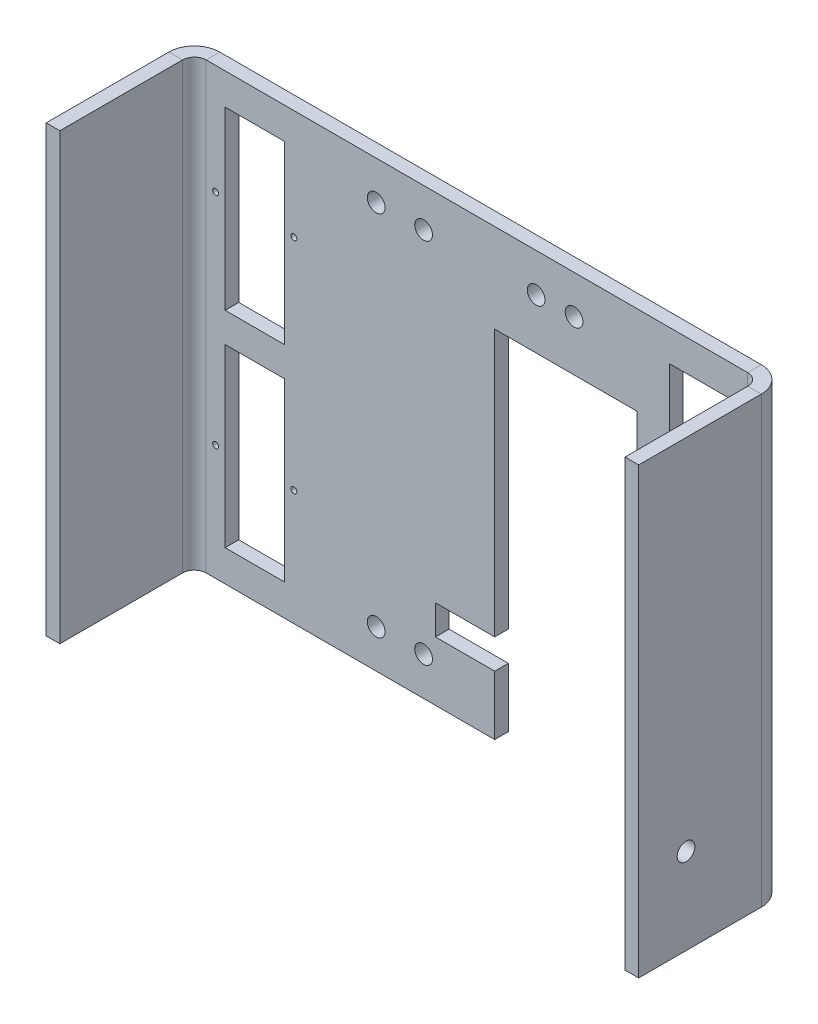
from build123d import *

# Parameters (mm, degrees)
SKETCH2_W                    = 100
SKETCH2_H                    = 75
BASE_FLANGE1_DEPTH           = 2.3
EDGE_FLANGE1_STRIP_W         = 13.2
EDGE_FLANGE1_STRIP_H         = 2.3
EDGE_FLANGE1_STRIP_CUT_DEPTH = 75
EDGE_FLANGE1_DEPTH           = 75
EDGE_FLANGE2_STRIP_W         = 13.2
EDGE_FLANGE2_STRIP_H         = 2.3
EDGE_FLANGE2_STRIP_CUT_DEPTH = 75
EDGE_FLANGE2_DEPTH           = 75
CUT_EXTRUDE1_REACH           = 129.475
SKETCH13_R                   = 1.5
SKETCH13_W                   = 10
SKETCH13_H                   = 64.4
SKETCH14_W                   = 10
SKETCH14_H                   = 5
TAB1_DEPTH                   = 2.3
CUT_EXTRUDE2_REACH           = 129.475
SKETCH17_R                   = 0.5
CUT_EXTRUDE3_REACH           = 129.044
SKETCH18_R                   = 1.5


# Sheet-metal steps are written as plain solids
with BuildPart() as part:
    # Sketch2 → Base-Flange1 (new body)
    with BuildSketch(Plane.XY):
        with Locations((50, 37.5)):
            Rectangle(SKETCH2_W, SKETCH2_H)
    extrude(amount=-BASE_FLANGE1_DEPTH)

    # Edge-Flange1 strip (across the edge) → Edge-Flange1 strip cut (cut)
    with BuildSketch(Plane.XZ.offset(-75)):
        with Locations((-2.3, -1.15)):
            Rectangle(EDGE_FLANGE1_STRIP_W, EDGE_FLANGE1_STRIP_H)
    extrude(amount=EDGE_FLANGE1_STRIP_CUT_DEPTH, mode=Mode.SUBTRACT)

    # Edge-Flange1 section (across the edge) → Edge-Flange1 (add)
    with BuildSketch(Plane.XZ.offset(-75)):
        with BuildLine():
            Line((0, 2), (0, 22.7))
            Line((0, 22.7), (2.3, 22.7))
            Line((2.3, 22.7), (2.3, 2))
            ThreePointArc((2.3, 2), (2.885786438, 0.585786438), (4.3, 0))
            Line((4.3, 0), (4.3, -2.3))
            ThreePointArc((4.3, -2.3), (1.259440841, -1.040559159), (0, 2))
        make_face()
    extrude(amount=EDGE_FLANGE1_DEPTH)

    # Edge-Flange2 strip (across the edge) → Edge-Flange2 strip cut (cut)
    with BuildSketch(Plane(origin=(100, 0, 0), x_dir=(-1, 0, 0), z_dir=(0, 1, 0))):
        with Locations((-2.3, -1.15)):
            Rectangle(EDGE_FLANGE2_STRIP_W, EDGE_FLANGE2_STRIP_H)
    extrude(amount=EDGE_FLANGE2_STRIP_CUT_DEPTH, mode=Mode.SUBTRACT)

    # Edge-Flange2 section (across the edge) → Edge-Flange2 (add)
    with BuildSketch(Plane(origin=(100, 0, 0), x_dir=(-1, 0, 0), z_dir=(0, 1, 0))):
        with BuildLine():
            Line((0, 2), (0, 22.7))
            Line((0, 22.7), (2.3, 22.7))
            Line((2.3, 22.7), (2.3, 2))
            ThreePointArc((2.3, 2), (2.885786438, 0.585786438), (4.3, 0))
            Line((4.3, 0), (4.3, -2.3))
            ThreePointArc((4.3, -2.3), (1.259440841, -1.040559159), (0, 2))
        make_face()
    extrude(amount=EDGE_FLANGE2_DEPTH)

    # Sketch13 → Cut-Extrude1 (cut, up to next)
    with BuildSketch(Plane(origin=(0, 0, -2.3), x_dir=(-1, 0, 0), z_dir=(0, 0, -1)), mode=Mode.PRIVATE) as cut_extrude1_sk1:
        with Locations((-66.4, 68.5)):
            Circle(SKETCH13_R)
    cut_extrude1_tool1 = extrude(cut_extrude1_sk1.sketch, amount=-CUT_EXTRUDE1_REACH, mode=Mode.PRIVATE) & part.part
    # Sketch13 → Cut-Extrude1 (cut, up to next)
    with BuildSketch(Plane(origin=(0, 0, -2.3), x_dir=(-1, 0, 0), z_dir=(0, 0, -1)), mode=Mode.PRIVATE) as cut_extrude1_sk2:
        with Locations((-60, 68.5)):
            Circle(SKETCH13_R)
    cut_extrude1_tool2 = extrude(cut_extrude1_sk2.sketch, amount=-CUT_EXTRUDE1_REACH, mode=Mode.PRIVATE) & part.part
    # Sketch13 → Cut-Extrude1 (cut, up to next)
    with BuildSketch(Plane(origin=(0, 0, -2.3), x_dir=(-1, 0, 0), z_dir=(0, 0, -1)), mode=Mode.PRIVATE) as cut_extrude1_sk3:
        with Locations((-41, 68.5)):
            Circle(SKETCH13_R)
    cut_extrude1_tool3 = extrude(cut_extrude1_sk3.sketch, amount=-CUT_EXTRUDE1_REACH, mode=Mode.PRIVATE) & part.part
    # Sketch13 → Cut-Extrude1 (cut, up to next)
    with BuildSketch(Plane(origin=(0, 0, -2.3), x_dir=(-1, 0, 0), z_dir=(0, 0, -1)), mode=Mode.PRIVATE) as cut_extrude1_sk4:
        with Locations((-33, 68.5)):
            Circle(SKETCH13_R)
    cut_extrude1_tool4 = extrude(cut_extrude1_sk4.sketch, amount=-CUT_EXTRUDE1_REACH, mode=Mode.PRIVATE) & part.part
    # Sketch13 → Cut-Extrude1 (cut, up to next)
    with BuildSketch(Plane(origin=(0, 0, -2.3), x_dir=(-1, 0, 0), z_dir=(0, 0, -1)), mode=Mode.PRIVATE) as cut_extrude1_sk5:
        with Locations((-41, 6.5)):
            Circle(SKETCH13_R)
    cut_extrude1_tool5 = extrude(cut_extrude1_sk5.sketch, amount=-CUT_EXTRUDE1_REACH, mode=Mode.PRIVATE) & part.part
    # Sketch13 → Cut-Extrude1 (cut, up to next)
    with BuildSketch(Plane(origin=(0, 0, -2.3), x_dir=(-1, 0, 0), z_dir=(0, 0, -1)), mode=Mode.PRIVATE) as cut_extrude1_sk6:
        with Locations((-33, 6.5)):
            Circle(SKETCH13_R)
    cut_extrude1_tool6 = extrude(cut_extrude1_sk6.sketch, amount=-CUT_EXTRUDE1_REACH, mode=Mode.PRIVATE) & part.part
    # Sketch13 → Cut-Extrude1 (cut, up to next)
    with BuildSketch(Plane(origin=(0, 0, -2.3), x_dir=(-1, 0, 0), z_dir=(0, 0, -1)), mode=Mode.PRIVATE) as cut_extrude1_sk7:
        Polygon((-77, 0), (-53, 0), (-53, 10), (-43, 10), (-43, 15), (-53, 15), (-53, 60), (-77, 60), align=None)
    cut_extrude1_tool7 = extrude(cut_extrude1_sk7.sketch, amount=-CUT_EXTRUDE1_REACH, mode=Mode.PRIVATE) & part.part
    # Sketch13 → Cut-Extrude1 (cut, up to next)
    with BuildSketch(Plane(origin=(0, 0, -2.3), x_dir=(-1, 0, 0), z_dir=(0, 0, -1)), mode=Mode.PRIVATE) as cut_extrude1_sk8:
        with Locations((-87.5, 37.5)):
            Rectangle(SKETCH13_W, SKETCH13_H)
    cut_extrude1_tool8 = extrude(cut_extrude1_sk8.sketch, amount=-CUT_EXTRUDE1_REACH, mode=Mode.PRIVATE) & part.part
    # Sketch13 → Cut-Extrude1 (cut, up to next)
    with BuildSketch(Plane(origin=(0, 0, -2.3), x_dir=(-1, 0, 0), z_dir=(0, 0, -1)), mode=Mode.PRIVATE) as cut_extrude1_sk9:
        with Locations((-12.5, 37.5)):
            Rectangle(SKETCH13_W, SKETCH13_H)
    cut_extrude1_tool9 = extrude(cut_extrude1_sk9.sketch, amount=-CUT_EXTRUDE1_REACH, mode=Mode.PRIVATE) & part.part
    add(cut_extrude1_tool1.solids().sort_by_distance((66.4, 68.5, -2.3))[0], mode=Mode.SUBTRACT)
    add(cut_extrude1_tool2.solids().sort_by_distance((60, 68.5, -2.3))[0], mode=Mode.SUBTRACT)
    add(cut_extrude1_tool3.solids().sort_by_distance((41, 68.5, -2.3))[0], mode=Mode.SUBTRACT)
    add(cut_extrude1_tool4.solids().sort_by_distance((33, 68.5, -2.3))[0], mode=Mode.SUBTRACT)
    add(cut_extrude1_tool5.solids().sort_by_distance((41, 6.5, -2.3))[0], mode=Mode.SUBTRACT)
    add(cut_extrude1_tool6.solids().sort_by_distance((33, 6.5, -2.3))[0], mode=Mode.SUBTRACT)
    add(cut_extrude1_tool7.solids().sort_by_distance((64.42953, 29.412752, -2.3))[0], mode=Mode.SUBTRACT)
    add(cut_extrude1_tool8.solids().sort_by_distance((87.5, 37.5, -2.3))[0], mode=Mode.SUBTRACT)
    add(cut_extrude1_tool9.solids().sort_by_distance((12.5, 37.5, -2.3))[0], mode=Mode.SUBTRACT)

    # Sketch14 → Tab1 (add)
    with BuildSketch(Plane(origin=(0, 0, -2.3), x_dir=(-1, 0, 0), z_dir=(0, 0, -1))):
        with Locations((-87.5, 37.5)):
            Rectangle(SKETCH14_W, SKETCH14_H)
        with Locations((-12.5, 37.5)):
            Rectangle(SKETCH14_W, SKETCH14_H)
    extrude(amount=-TAB1_DEPTH)

    # Sketch17 → Cut-Extrude2 (cut, up to next)
    with BuildSketch(Plane(origin=(0, 0, -2.3), x_dir=(-1, 0, 0), z_dir=(0, 0, -1)), mode=Mode.PRIVATE) as cut_extrude2_sk1:
        with Locations((-94.1, 56.5)):
            Circle(SKETCH17_R)
    cut_extrude2_tool1 = extrude(cut_extrude2_sk1.sketch, amount=-CUT_EXTRUDE2_REACH, mode=Mode.PRIVATE) & part.part
    # Sketch17 → Cut-Extrude2 (cut, up to next)
    with BuildSketch(Plane(origin=(0, 0, -2.3), x_dir=(-1, 0, 0), z_dir=(0, 0, -1)), mode=Mode.PRIVATE) as cut_extrude2_sk2:
        with Locations((-94.1, 19.5)):
            Circle(SKETCH17_R)
    cut_extrude2_tool2 = extrude(cut_extrude2_sk2.sketch, amount=-CUT_EXTRUDE2_REACH, mode=Mode.PRIVATE) & part.part
    # Sketch17 → Cut-Extrude2 (cut, up to next)
    with BuildSketch(Plane(origin=(0, 0, -2.3), x_dir=(-1, 0, 0), z_dir=(0, 0, -1)), mode=Mode.PRIVATE) as cut_extrude2_sk3:
        with Locations((-80.9, 19.5)):
            Circle(SKETCH17_R)
    cut_extrude2_tool3 = extrude(cut_extrude2_sk3.sketch, amount=-CUT_EXTRUDE2_REACH, mode=Mode.PRIVATE) & part.part
    # Sketch17 → Cut-Extrude2 (cut, up to next)
    with BuildSketch(Plane(origin=(0, 0, -2.3), x_dir=(-1, 0, 0), z_dir=(0, 0, -1)), mode=Mode.PRIVATE) as cut_extrude2_sk4:
        with Locations((-80.9, 56.5)):
            Circle(SKETCH17_R)
    cut_extrude2_tool4 = extrude(cut_extrude2_sk4.sketch, amount=-CUT_EXTRUDE2_REACH, mode=Mode.PRIVATE) & part.part
    # Sketch17 → Cut-Extrude2 (cut, up to next)
    with BuildSketch(Plane(origin=(0, 0, -2.3), x_dir=(-1, 0, 0), z_dir=(0, 0, -1)), mode=Mode.PRIVATE) as cut_extrude2_sk5:
        with Locations((-19.1, 19.5)):
            Circle(SKETCH17_R)
    cut_extrude2_tool5 = extrude(cut_extrude2_sk5.sketch, amount=-CUT_EXTRUDE2_REACH, mode=Mode.PRIVATE) & part.part
    # Sketch17 → Cut-Extrude2 (cut, up to next)
    with BuildSketch(Plane(origin=(0, 0, -2.3), x_dir=(-1, 0, 0), z_dir=(0, 0, -1)), mode=Mode.PRIVATE) as cut_extrude2_sk6:
        with Locations((-5.9, 19.5)):
            Circle(SKETCH17_R)
    cut_extrude2_tool6 = extrude(cut_extrude2_sk6.sketch, amount=-CUT_EXTRUDE2_REACH, mode=Mode.PRIVATE) & part.part
    # Sketch17 → Cut-Extrude2 (cut, up to next)
    with BuildSketch(Plane(origin=(0, 0, -2.3), x_dir=(-1, 0, 0), z_dir=(0, 0, -1)), mode=Mode.PRIVATE) as cut_extrude2_sk7:
        with Locations((-5.9, 56.5)):
            Circle(SKETCH17_R)
    cut_extrude2_tool7 = extrude(cut_extrude2_sk7.sketch, amount=-CUT_EXTRUDE2_REACH, mode=Mode.PRIVATE) & part.part
    # Sketch17 → Cut-Extrude2 (cut, up to next)
    with BuildSketch(Plane(origin=(0, 0, -2.3), x_dir=(-1, 0, 0), z_dir=(0, 0, -1)), mode=Mode.PRIVATE) as cut_extrude2_sk8:
        with Locations((-19.1, 56.5)):
            Circle(SKETCH17_R)
    cut_extrude2_tool8 = extrude(cut_extrude2_sk8.sketch, amount=-CUT_EXTRUDE2_REACH, mode=Mode.PRIVATE) & part.part
    add(cut_extrude2_tool1.solids().sort_by_distance((94.1, 56.5, -2.3))[0], mode=Mode.SUBTRACT)
    add(cut_extrude2_tool2.solids().sort_by_distance((94.1, 19.5, -2.3))[0], mode=Mode.SUBTRACT)
    add(cut_extrude2_tool3.solids().sort_by_distance((80.9, 19.5, -2.3))[0], mode=Mode.SUBTRACT)
    add(cut_extrude2_tool4.solids().sort_by_distance((80.9, 56.5, -2.3))[0], mode=Mode.SUBTRACT)
    add(cut_extrude2_tool5.solids().sort_by_distance((19.1, 19.5, -2.3))[0], mode=Mode.SUBTRACT)
    add(cut_extrude2_tool6.solids().sort_by_distance((5.9, 19.5, -2.3))[0], mode=Mode.SUBTRACT)
    add(cut_extrude2_tool7.solids().sort_by_distance((5.9, 56.5, -2.3))[0], mode=Mode.SUBTRACT)
    add(cut_extrude2_tool8.solids().sort_by_distance((19.1, 56.5, -2.3))[0], mode=Mode.SUBTRACT)

    # Sketch18 → Cut-Extrude3 (cut, up to next)
    with BuildSketch(Plane(origin=(100, 0, 0), x_dir=(0, 0, -1), z_dir=(1, 0, 0)), mode=Mode.PRIVATE) as cut_extrude3_sk1:
        with Locations((-14.7, 14.5)):
            Circle(SKETCH18_R)
    cut_extrude3_tool1 = extrude(cut_extrude3_sk1.sketch, amount=-CUT_EXTRUDE3_REACH, mode=Mode.PRIVATE) & part.part
    add(cut_extrude3_tool1.solids().sort_by_distance((100, 14.5, 14.7))[0], mode=Mode.SUBTRACT)


solid = part.part
